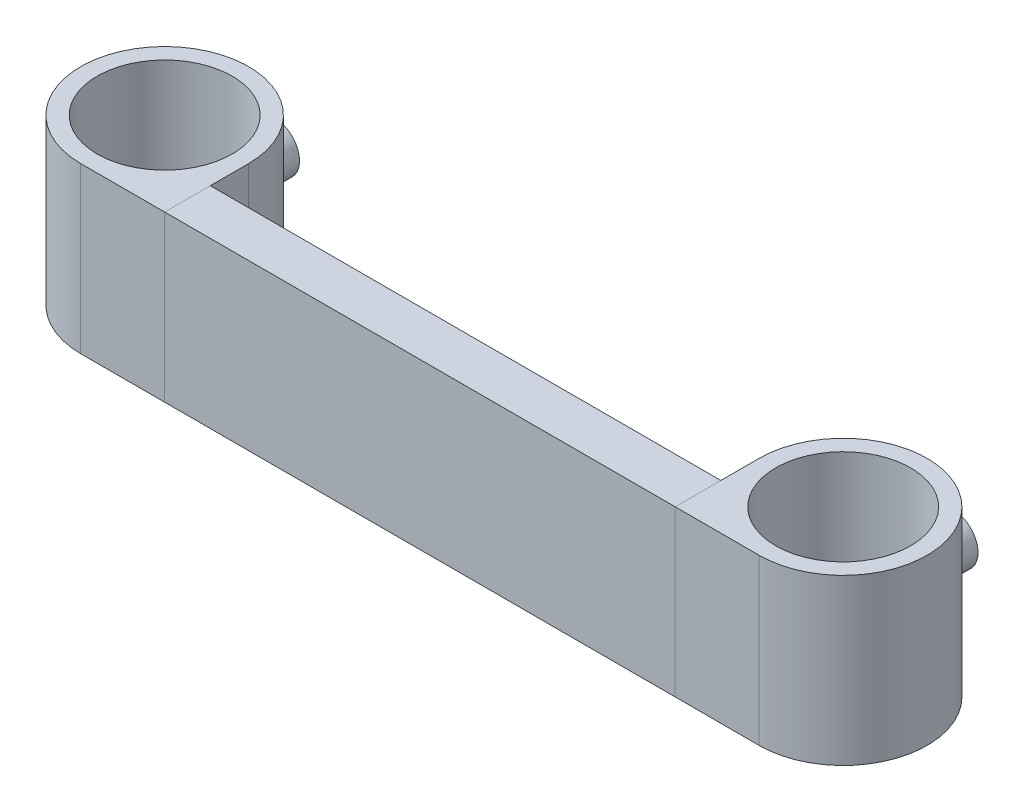
from build123d import *

# Parameters (mm, degrees)
SKETCH2_R           = 20.5
BOSS_EXTRUDE1_DEPTH = 50
SKETCH3_R           = 7.5
BOSS_EXTRUDE2_DEPTH = 10
CUT_EXTRUDE1_REACH  = 151.951
SKETCH4_R           = 2
CHAMFER1_SIZE       = 4
SPLIT1_START        = -48.0000001
SPLIT1_OUTLINE_R    = 7.5
SPLIT1_OUTLINE_R_2  = 2
SPLIT1_DEPTH        = 8.932510964
SPLIT1_2_OUTLINE_R  = 20.5
SPLIT1_2_DEPTH      = 50
SPLIT1_3_OUTLINE_W  = 2
SPLIT1_3_OUTLINE_H  = 9.030358149
SPLIT1_START_2      = -77.5
SPLIT1_5_OUTLINE_W  = 50
SPLIT1_5_OUTLINE_H  = 13.865021928
SPLIT1_5_DEPTH      = 155
SPLIT1_START_3      = -130
SPLIT1_6_OUTLINE_W  = 50
SPLIT1_6_OUTLINE_H  = 58.932510964
SPLIT1_6_DEPTH      = 207.5


with BuildPart() as part:
    # Sketch2 → Boss-Extrude1 (new body)
    # profile 1 of 2: a face of its own
    with BuildSketch(Plane(origin=(0, 0, 0), x_dir=(1, 0, 0), z_dir=(0, 1, 0))):
        with BuildLine():
            ThreePointArc((-77.5, 18.567489036), (-121.03122292, 36.598711956), (-103, -6.932510964))
            Line((-103, -6.932510964), (-85, -6.932510964))
            Line((-85, -6.932510964), (0, -6.932510964))
            Line((0, -6.932510964), (0, 6.932510964))
            Line((0, 6.932510964), (-77.5, 6.932510964))
            Line((-77.5, 6.932510964), (-77.5, 18.567489036))
        make_face()
        with Locations(Location((-103, 18.567489036, 0), (0, 0, 270))):
            Circle(SKETCH2_R, mode=Mode.SUBTRACT)
    # profile 2 of 2: a face of its own
    with BuildSketch(Plane(origin=(0, 0, 0), x_dir=(1, 0, 0), z_dir=(0, 1, 0))):
        with BuildLine():
            Line((0, 6.932510964), (0, -6.932510964))
            Line((0, -6.932510964), (85, -6.932510964))
            Line((85, -6.932510964), (103, -6.932510964))
            ThreePointArc((103, -6.932510964), (121.03122292, 36.598711956), (77.5, 18.567489036))
            Line((77.5, 18.567489036), (77.5, 6.932510964))
            Line((77.5, 6.932510964), (0, 6.932510964))
        make_face()
        with Locations(Location((103, 18.567489036, 0), (0, 0, 270))):
            Circle(SKETCH2_R, mode=Mode.SUBTRACT)
    extrude(amount=BOSS_EXTRUDE1_DEPTH)

    # Sketch3 → Boss-Extrude2 (add)
    with BuildSketch(Plane.XY.offset(-42)):
        with Locations((103, 25)):
            Circle(SKETCH3_R)
        with Locations((-103, 25)):
            Circle(SKETCH3_R)
    extrude(amount=-BOSS_EXTRUDE2_DEPTH)

    # Sketch4 → Cut-Extrude1 (cut, up to next)
    with BuildSketch(Plane(origin=(0, 0, -52), x_dir=(-1, 0, 0), z_dir=(0, 0, -1)), mode=Mode.PRIVATE) as cut_extrude1_sk1:
        with Locations((103, 25)):
            Circle(SKETCH4_R)
    cut_extrude1_tool1 = extrude(cut_extrude1_sk1.sketch, amount=-CUT_EXTRUDE1_REACH, mode=Mode.PRIVATE) & part.part
    # Sketch4 → Cut-Extrude1 (cut, up to next)
    with BuildSketch(Plane(origin=(0, 0, -52), x_dir=(-1, 0, 0), z_dir=(0, 0, -1)), mode=Mode.PRIVATE) as cut_extrude1_sk2:
        with Locations((-103, 25)):
            Circle(SKETCH4_R)
    cut_extrude1_tool2 = extrude(cut_extrude1_sk2.sketch, amount=-CUT_EXTRUDE1_REACH, mode=Mode.PRIVATE) & part.part
    add(cut_extrude1_tool1.solids().sort_by_distance((-103, 25, -52))[0], mode=Mode.SUBTRACT)
    add(cut_extrude1_tool2.solids().sort_by_distance((103, 25, -52))[0], mode=Mode.SUBTRACT)

    # Chamfer1
    chamfer1_edges = [part.edges().sort_by_distance(p)[0] for p in [
        (-101, 25, -52),
        (105, 25, -52),
    ]]
    chamfer(chamfer1_edges, length=CHAMFER1_SIZE)

    # Split1 6 outline → Split1 6 (cut)
    with BuildSketch(Plane.YZ.offset(SPLIT1_START_3)):
        with Locations((25, -22.533744518)):
            Rectangle(SPLIT1_6_OUTLINE_W, SPLIT1_6_OUTLINE_H)
    extrude(amount=SPLIT1_6_DEPTH, mode=Mode.SUBTRACT)


with BuildPart() as body_2:
    # Split1: read off the stored shape, not the designer's step
    # Split1 outline → Split1 (new body)
    with BuildSketch(Plane.XY.offset(SPLIT1_START)):
        with Locations((-103, 25)):
            Circle(SPLIT1_OUTLINE_R)
        with Locations((-103, 25)):
            Circle(SPLIT1_OUTLINE_R_2, mode=Mode.SUBTRACT)
    extrude(amount=SPLIT1_DEPTH)

    # Split1 2 outline → Split1 2 (add)
    with BuildSketch(Plane(origin=(0, 0, 0), x_dir=(1, 0, 0), z_dir=(0, 1, 0))):
        with BuildLine():
            Line((-103, -6.932510964), (-77.5, -6.932510964))
            Line((-77.5, -6.932510964), (-77.5, 18.567489036))
            ThreePointArc((-77.5, 18.567489036), (-121.03122292, 36.598711956), (-103, -6.932510964))
        make_face()
        with Locations((-103, 18.567489036)):
            Circle(SPLIT1_2_OUTLINE_R, mode=Mode.SUBTRACT)
    extrude(amount=SPLIT1_2_DEPTH)

    # Split1 3 outline → Split1 3 (revolve, cut)
    with BuildSketch(Plane(origin=(-103, 25, 0), x_dir=(1, 0, 0), z_dir=(0, -1, 0))):
        with Locations((1, -43.484821025)):
            Rectangle(SPLIT1_3_OUTLINE_W, SPLIT1_3_OUTLINE_H)
    revolve(axis=Axis((-103, 25, 0), (0, 0, 1)), mode=Mode.SUBTRACT)

    # Split1 4 outline → Split1 4 (revolve)
    with BuildSketch(Plane(origin=(-103, 25, 0), x_dir=(1, 0, 0), z_dir=(0, -1, 0))):
        Polygon((7.5, -48.0000001), (2, -48.0000001), (6, -52), (7.5, -52), align=None)
    revolve(axis=Axis((-103, 25, 0), (0, 0, 1)))


with BuildPart() as body_3:
    # Split1 5 outline → Split1 5 (new body)
    with BuildSketch(Plane.YZ.offset(SPLIT1_START_2)):
        with Locations((25, 0)):
            Rectangle(SPLIT1_5_OUTLINE_W, SPLIT1_5_OUTLINE_H)
    extrude(amount=SPLIT1_5_DEPTH)


solid = Compound([part.part, body_2.part, body_3.part])
